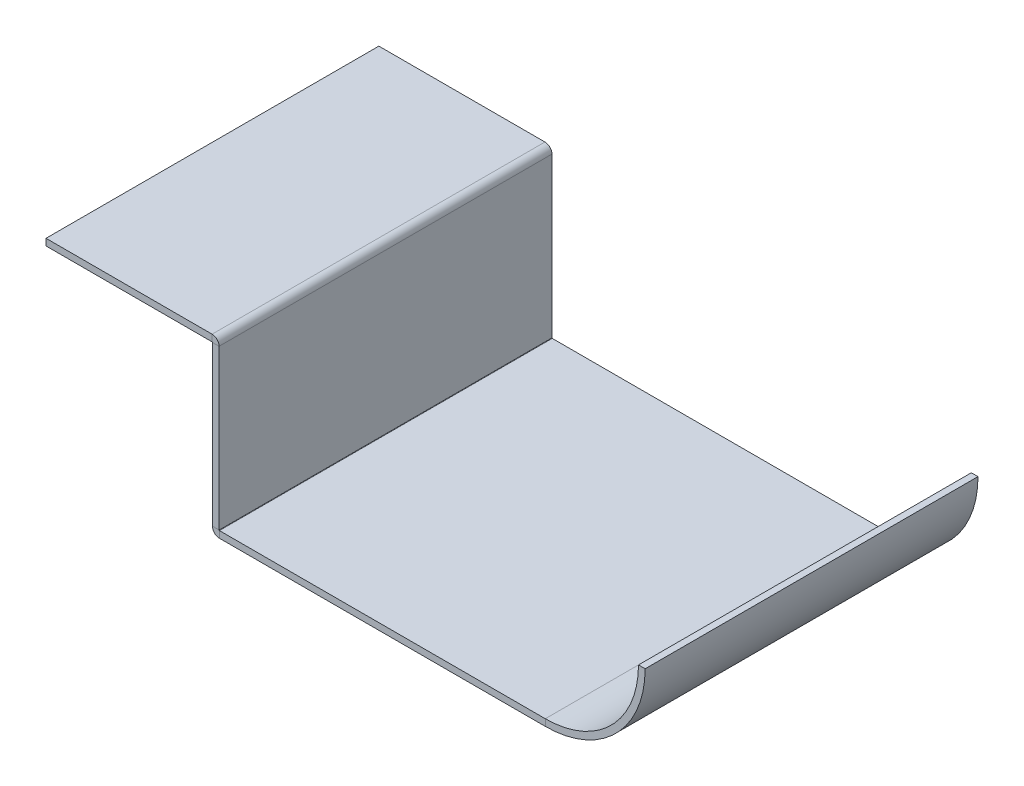
from build123d import *

# Parameters (mm, degrees)
SM_BASE_FLANGE_1_DEPTH = 100


# Sheet-metal steps are written as plain solids
with BuildPart() as part:
    # Sketch 1 → 基体-法兰1 (new body)
    with BuildSketch(Plane.XY):
        with BuildLine():
            Line((-50, 50), (-0.1, 50))
            ThreePointArc((-0.1, 50), (-0.029289322, 49.970710678), (0, 49.9))
            Line((0, 49.9), (0, 2.1))
            ThreePointArc((0, 2.1), (0.61507576, 0.61507576), (2.1, 0))
            Line((2.1, 0), (100, 0))
            ThreePointArc((100, 0), (121.213203436, 8.786796564), (130, 30))
            Line((130, 30), (128, 30))
            ThreePointArc((128, 30), (119.798989873, 10.201010127), (100, 2))
            Line((100, 2), (2.1, 2))
            ThreePointArc((2.1, 2), (2.029289322, 2.029289322), (2, 2.1))
            Line((2, 2.1), (2, 49.9))
            ThreePointArc((2, 49.9), (1.384924241, 51.38492424), (-0.1, 52))
            Line((-0.1, 52), (-50, 52))
            Line((-50, 52), (-50, 50))
        make_face()
    extrude(amount=-SM_BASE_FLANGE_1_DEPTH)


solid = part.part
